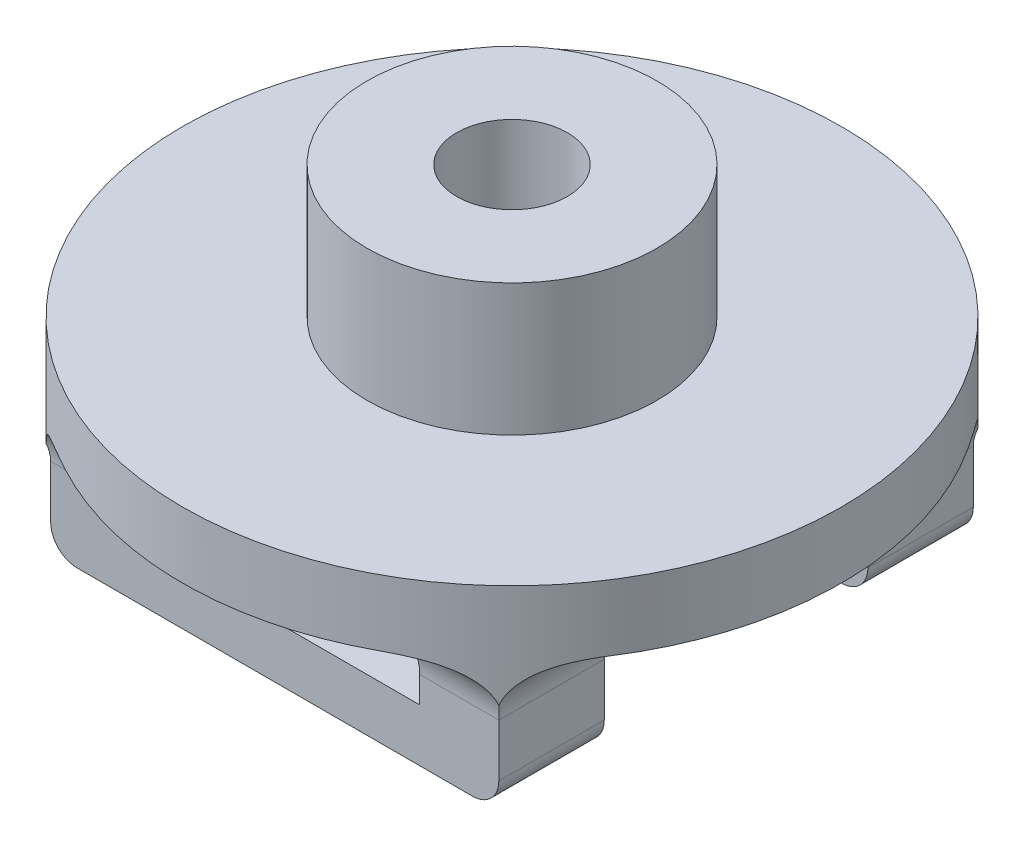
from build123d import *

# Parameters (mm, degrees)
SKETCH1_R                 = 12.5
BOSS_EXTRUDE1_DEPTH       = 2.5
SKETCH2_R                 = 5.5
BOSS_EXTRUDE2_DEPTH       = 5
F_3_0MM_DOWEL_HOLE1_D     = 4.2
F_3_0MM_DOWEL_HOLE1_DEPTH = 10
F_3_0MM_DOWEL_HOLE1_TIP   = 1.2618073
BOSS_EXTRUDE3_START       = -3
BOSS_EXTRUDE3_DEPTH       = 4
FILLET1_R                 = 2
FILLET2_R                 = 1


with BuildPart() as part:
    # Sketch1 → Boss-Extrude1 (new body)
    with BuildSketch(Plane(origin=(0, 0, 0), x_dir=(1, 0, 0), z_dir=(0, 1, 0))):
        with Locations(Location((0, 0, 0), (0, 0, 270))):
            Circle(SKETCH1_R)
    extrude(amount=BOSS_EXTRUDE1_DEPTH)

    # Sketch2 → Boss-Extrude2 (add)
    with BuildSketch(Plane(origin=(0, 2.5, 0), x_dir=(1, 0, 0), z_dir=(0, 1, 0))):
        with Locations(Location((0, 0, 0), (0, 0, 270))):
            Circle(SKETCH2_R)
    extrude(amount=BOSS_EXTRUDE2_DEPTH)

    # Ø3.0mm Dowel Hole1
    with Locations(Plane(origin=(0, 0, 0), x_dir=(-1, 0, 0), z_dir=(0, -1, 0))):
        with Locations((0, 0)):
            Hole(F_3_0MM_DOWEL_HOLE1_D / 2, depth=F_3_0MM_DOWEL_HOLE1_DEPTH)
            with Locations((0, 0, -(F_3_0MM_DOWEL_HOLE1_DEPTH + F_3_0MM_DOWEL_HOLE1_TIP / 2))):  # 118° drill point
                Cone(0, F_3_0MM_DOWEL_HOLE1_D / 2, F_3_0MM_DOWEL_HOLE1_TIP, mode=Mode.SUBTRACT)

    # Sketch6 → Boss-Extrude3 (add)
    with BuildSketch(Plane.XY.offset(8).offset(BOSS_EXTRUDE3_START)):
        Polygon((-5.5, 0), (-8.5, 0), (-8.5, -5), (8.5, -5), (8.5, 0), (5.5, 0), (5.5, -3), (-5.5, -3), align=None)
    boss_extrude3 = extrude(amount=BOSS_EXTRUDE3_DEPTH)

    # Mirror1: Boss-Extrude3 across plane
    add(boss_extrude3.mirror(Plane.XY))

    # Fillet1
    # the kernel refuses this fillet: 2 mm, written as the material it adds along each edge
    with BuildSketch(Plane(origin=(8.5, 0, 5), x_dir=(1, 0, 0), z_dir=(0, 0, 1))) as fillet1_piece_1_section:
        with BuildLine():
            CenterArc((FILLET1_R, -FILLET1_R), FILLET1_R, 90, 90)
            Line((0, -FILLET1_R), (0, 0))
            Line((0, 0), (FILLET1_R, 0))
        make_face()
    fillet1_piece_1 = extrude(amount=4, mode=Mode.PRIVATE)
    fillet1_piece_1 = fillet1_piece_1 & Plane(origin=(0, -0.480708784, 0), x_dir=(0, 0, 1), z_dir=(0, -1, 0)) * Cylinder(12.5, 16, mode=Mode.PRIVATE)
    add(fillet1_piece_1)
    with BuildSketch(Plane(origin=(8.5, 0, 9), x_dir=(0, 0, 1), z_dir=(-1, 0, 0))) as fillet1_piece_2_section:
        with BuildLine():
            CenterArc((FILLET1_R, -FILLET1_R), FILLET1_R, 90, 90)
            Line((0, -FILLET1_R), (0, 0))
            Line((0, 0), (FILLET1_R, 0))
        make_face()
    fillet1_piece_2 = extrude(amount=3, mode=Mode.PRIVATE)
    fillet1_piece_2 = fillet1_piece_2 & Plane(origin=(0, -0.497609904, 0), x_dir=(0, 0, 1), z_dir=(0, -1, 0)) * Cylinder(12.5, 14, mode=Mode.PRIVATE)
    add(fillet1_piece_2)
    with BuildSketch(Plane(origin=(-5.5, 0, 9), x_dir=(0, 0, 1), z_dir=(-1, 0, 0))) as fillet1_piece_3_section:
        with BuildLine():
            CenterArc((FILLET1_R, -FILLET1_R), FILLET1_R, 90, 90)
            Line((0, -FILLET1_R), (0, 0))
            Line((0, 0), (FILLET1_R, 0))
        make_face()
    fillet1_piece_3 = extrude(amount=3, mode=Mode.PRIVATE)
    fillet1_piece_3 = fillet1_piece_3 & Plane(origin=(0, -0.497609936, 0), x_dir=(0, 0, 1), z_dir=(0, -1, 0)) * Cylinder(12.5, 14, mode=Mode.PRIVATE)
    add(fillet1_piece_3)
    with BuildSketch(Plane(origin=(-8.5, 0, 5), x_dir=(-1, 0, 0), z_dir=(0, 0, 1))) as fillet1_piece_4_section:
        with BuildLine():
            CenterArc((FILLET1_R, FILLET1_R), FILLET1_R, 180, 90)
            Line((0, FILLET1_R), (0, 0))
            Line((0, 0), (FILLET1_R, 0))
        make_face()
    fillet1_piece_4 = extrude(amount=4, mode=Mode.PRIVATE)
    fillet1_piece_4 = fillet1_piece_4 & Plane(origin=(0, -0.48070882, 0), x_dir=(0, 0, 1), z_dir=(0, -1, 0)) * Cylinder(12.5, 16, mode=Mode.PRIVATE)
    add(fillet1_piece_4)
    with BuildSketch(Plane(origin=(8.5, 0, 5), x_dir=(0, 0, -1), z_dir=(-1, 0, 0)), Plane(origin=(-5.5, 0, 5), x_dir=(0, 0, -1), z_dir=(-1, 0, 0))) as fillet1_piece_5:
        with BuildLine():
            CenterArc((FILLET1_R, FILLET1_R), FILLET1_R, 180, 90)
            Line((0, FILLET1_R), (0, 0))
            Line((0, 0), (FILLET1_R, 0))
        make_face()
    extrude(amount=3)
    with BuildSketch(Plane(origin=(8.5, 0, -5), x_dir=(0, 0, 1), z_dir=(-1, 0, 0)), Plane(origin=(-5.5, 0, -5), x_dir=(0, 0, 1), z_dir=(-1, 0, 0))) as fillet1_piece_6:
        with BuildLine():
            CenterArc((FILLET1_R, -FILLET1_R), FILLET1_R, 90, 90)
            Line((0, -FILLET1_R), (0, 0))
            Line((0, 0), (FILLET1_R, 0))
        make_face()
    extrude(amount=3)
    with BuildSketch(Plane(origin=(8.5, 0, -5), x_dir=(1, 0, 0), z_dir=(0, 0, -1))) as fillet1_piece_7_section:
        with BuildLine():
            CenterArc((FILLET1_R, FILLET1_R), FILLET1_R, 180, 90)
            Line((0, FILLET1_R), (0, 0))
            Line((0, 0), (FILLET1_R, 0))
        make_face()
    fillet1_piece_7 = extrude(amount=4, mode=Mode.PRIVATE)
    fillet1_piece_7 = fillet1_piece_7 & Plane(origin=(0, -0.48070882, 0), x_dir=(0, 0, 1), z_dir=(0, -1, 0)) * Cylinder(12.5, 16, mode=Mode.PRIVATE)
    add(fillet1_piece_7)
    with BuildSketch(Plane(origin=(-8.5, 0, -5), x_dir=(-1, 0, 0), z_dir=(0, 0, -1))) as fillet1_piece_8_section:
        with BuildLine():
            CenterArc((FILLET1_R, -FILLET1_R), FILLET1_R, 90, 90)
            Line((0, -FILLET1_R), (0, 0))
            Line((0, 0), (FILLET1_R, 0))
        make_face()
    fillet1_piece_8 = extrude(amount=4, mode=Mode.PRIVATE)
    fillet1_piece_8 = fillet1_piece_8 & Plane(origin=(0, -0.480708785, 0), x_dir=(0, 0, 1), z_dir=(0, -1, 0)) * Cylinder(12.5, 16, mode=Mode.PRIVATE)
    add(fillet1_piece_8)
    with BuildSketch(Plane(origin=(8.5, 0, -9), x_dir=(0, 0, -1), z_dir=(-1, 0, 0))) as fillet1_piece_9_section:
        with BuildLine():
            CenterArc((FILLET1_R, FILLET1_R), FILLET1_R, 180, 90)
            Line((0, FILLET1_R), (0, 0))
            Line((0, 0), (FILLET1_R, 0))
        make_face()
    fillet1_piece_9 = extrude(amount=3, mode=Mode.PRIVATE)
    fillet1_piece_9 = fillet1_piece_9 & Plane(origin=(0, -0.497609946, 0), x_dir=(0, 0, 1), z_dir=(0, -1, 0)) * Cylinder(12.5, 14, mode=Mode.PRIVATE)
    add(fillet1_piece_9)
    with BuildSketch(Plane(origin=(-5.5, 0, -9), x_dir=(0, 0, -1), z_dir=(-1, 0, 0))) as fillet1_piece_10_section:
        with BuildLine():
            CenterArc((FILLET1_R, FILLET1_R), FILLET1_R, 180, 90)
            Line((0, FILLET1_R), (0, 0))
            Line((0, 0), (FILLET1_R, 0))
        make_face()
    fillet1_piece_10 = extrude(amount=3, mode=Mode.PRIVATE)
    fillet1_piece_10 = fillet1_piece_10 & Plane(origin=(0, -0.497609939, 0), x_dir=(0, 0, 1), z_dir=(0, -1, 0)) * Cylinder(12.5, 14, mode=Mode.PRIVATE)
    add(fillet1_piece_10)
    with BuildSketch(Plane(origin=(13.5, 0, 5), x_dir=(0, 0, -1), z_dir=(-1, 0, 0))) as fillet1_piece_11a_section:
        with BuildLine():
            CenterArc((FILLET1_R, FILLET1_R), FILLET1_R, 180, 90)
            Line((0, FILLET1_R), (0, 0))
            Line((0, 0), (FILLET1_R, 0))
        make_face()
    fillet1_piece_11a = extrude(amount=8, mode=Mode.PRIVATE)
    fillet1_piece_11a = fillet1_piece_11a & Plane(origin=(0, -0.439550535, 0), x_dir=(0, 0, 1), z_dir=(0, -1, 0)) * Cylinder(12.5, 24, mode=Mode.PRIVATE)
    fillet1_piece_11a = split(fillet1_piece_11a, bisect_by=Plane(origin=(8.5, -0.439550535, 4.525411001), z_dir=(1, 0, 0)), keep=Keep.TOP, mode=Mode.PRIVATE)
    with BuildSketch(Plane(origin=(8.5, 0, 0), x_dir=(1, 0, 0), z_dir=(0, 0, 1))) as fillet1_piece_11b_section:
        with BuildLine():
            CenterArc((FILLET1_R, -FILLET1_R), FILLET1_R, 90, 90)
            Line((0, -FILLET1_R), (0, 0))
            Line((0, 0), (FILLET1_R, 0))
        make_face()
    fillet1_piece_11b = extrude(amount=9, mode=Mode.PRIVATE)
    fillet1_piece_11b = split(fillet1_piece_11b, bisect_by=Plane(origin=(8.952790229, -0.452790229, 5), z_dir=(0, 0, -1)), keep=Keep.TOP, mode=Mode.PRIVATE)
    fillet1_piece_11 = fillet1_piece_11a & fillet1_piece_11b
    add(fillet1_piece_11)
    with BuildSketch(Plane(origin=(8.5, 0, 5), x_dir=(1, 0, 0), z_dir=(0, 0, 1))) as fillet1_piece_12a_section:
        with BuildLine():
            CenterArc((FILLET1_R, -FILLET1_R), FILLET1_R, 90, 90)
            Line((0, -FILLET1_R), (0, 0))
            Line((0, 0), (FILLET1_R, 0))
        make_face()
    fillet1_piece_12a = extrude(amount=9, mode=Mode.PRIVATE)
    fillet1_piece_12a = fillet1_piece_12a & Plane(origin=(0, -0.851863441, 0), x_dir=(0, 0, 1), z_dir=(0, -1, 0)) * Cylinder(12.5, 26, mode=Mode.PRIVATE)
    fillet1_piece_12a = split(fillet1_piece_12a, bisect_by=Plane(origin=(8.524607879, -0.851863441, 9), z_dir=(0, 0, 1)), keep=Keep.TOP, mode=Mode.PRIVATE)
    with BuildSketch(Plane(origin=(13.5, 0, 9), x_dir=(0, 0, 1), z_dir=(-1, 0, 0))) as fillet1_piece_12b_section:
        with BuildLine():
            CenterArc((FILLET1_R, -FILLET1_R), FILLET1_R, 90, 90)
            Line((0, -FILLET1_R), (0, 0))
            Line((0, 0), (FILLET1_R, 0))
        make_face()
    fillet1_piece_12b = extrude(amount=8, mode=Mode.PRIVATE)
    fillet1_piece_12b = fillet1_piece_12b & Plane(origin=(0, -0.857818141, 0), x_dir=(0, 0, 1), z_dir=(0, -1, 0)) * Cylinder(12.5, 24, mode=Mode.PRIVATE)
    fillet1_piece_12b = split(fillet1_piece_12b, bisect_by=Plane(origin=(8.5, -0.857818141, 9.021962646), z_dir=(1, 0, 0)), keep=Keep.TOP, mode=Mode.PRIVATE)
    fillet1_piece_12 = fillet1_piece_12a & fillet1_piece_12b
    add(fillet1_piece_12)
    with BuildSketch(Plane(origin=(-8.5, 0, 5), x_dir=(-1, 0, 0), z_dir=(0, 0, 1))) as fillet1_piece_13a_section:
        with BuildLine():
            CenterArc((FILLET1_R, FILLET1_R), FILLET1_R, 180, 90)
            Line((0, FILLET1_R), (0, 0))
            Line((0, 0), (FILLET1_R, 0))
        make_face()
    fillet1_piece_13a = extrude(amount=9, mode=Mode.PRIVATE)
    fillet1_piece_13a = fillet1_piece_13a & Plane(origin=(0, -0.851863441, 0), x_dir=(0, 0, 1), z_dir=(0, -1, 0)) * Cylinder(12.5, 26, mode=Mode.PRIVATE)
    fillet1_piece_13a = split(fillet1_piece_13a, bisect_by=Plane(origin=(-8.524607879, -0.851863441, 9), z_dir=(0, 0, 1)), keep=Keep.TOP, mode=Mode.PRIVATE)
    with BuildSketch(Plane(origin=(-5.5, 0, 9), x_dir=(0, 0, 1), z_dir=(-1, 0, 0))) as fillet1_piece_13b_section:
        with BuildLine():
            CenterArc((FILLET1_R, -FILLET1_R), FILLET1_R, 90, 90)
            Line((0, -FILLET1_R), (0, 0))
            Line((0, 0), (FILLET1_R, 0))
        make_face()
    fillet1_piece_13b = extrude(amount=8, mode=Mode.PRIVATE)
    fillet1_piece_13b = fillet1_piece_13b & Plane(origin=(0, -0.857818141, 0), x_dir=(0, 0, 1), z_dir=(0, -1, 0)) * Cylinder(12.5, 24, mode=Mode.PRIVATE)
    fillet1_piece_13b = split(fillet1_piece_13b, bisect_by=Plane(origin=(-8.5, -0.857818141, 9.021962647), z_dir=(-1, 0, 0)), keep=Keep.TOP, mode=Mode.PRIVATE)
    fillet1_piece_13 = fillet1_piece_13a & fillet1_piece_13b
    add(fillet1_piece_13)
    with BuildSketch(Plane(origin=(-5.5, 0, 5), x_dir=(0, 0, -1), z_dir=(-1, 0, 0))) as fillet1_piece_14a_section:
        with BuildLine():
            CenterArc((FILLET1_R, FILLET1_R), FILLET1_R, 180, 90)
            Line((0, FILLET1_R), (0, 0))
            Line((0, 0), (FILLET1_R, 0))
        make_face()
    fillet1_piece_14a = extrude(amount=8, mode=Mode.PRIVATE)
    fillet1_piece_14a = fillet1_piece_14a & Plane(origin=(0, -0.439548718, 0), x_dir=(0, 0, 1), z_dir=(0, -1, 0)) * Cylinder(12.5, 24, mode=Mode.PRIVATE)
    fillet1_piece_14a = split(fillet1_piece_14a, bisect_by=Plane(origin=(-8.5, -0.439548718, 4.525414754), z_dir=(-1, 0, 0)), keep=Keep.TOP, mode=Mode.PRIVATE)
    with BuildSketch(Plane(origin=(-8.5, 0, 0), x_dir=(-1, 0, 0), z_dir=(0, 0, 1))) as fillet1_piece_14b_section:
        with BuildLine():
            CenterArc((FILLET1_R, FILLET1_R), FILLET1_R, 180, 90)
            Line((0, FILLET1_R), (0, 0))
            Line((0, 0), (FILLET1_R, 0))
        make_face()
    fillet1_piece_14b = extrude(amount=9, mode=Mode.PRIVATE)
    fillet1_piece_14b = split(fillet1_piece_14b, bisect_by=Plane(origin=(-8.952790229, -0.452790229, 5), z_dir=(0, 0, -1)), keep=Keep.TOP, mode=Mode.PRIVATE)
    fillet1_piece_14 = fillet1_piece_14a & fillet1_piece_14b
    add(fillet1_piece_14)
    with BuildSketch(Plane(origin=(8.5, 0, 0), x_dir=(1, 0, 0), z_dir=(0, 0, -1))) as fillet1_piece_15a_section:
        with BuildLine():
            CenterArc((FILLET1_R, FILLET1_R), FILLET1_R, 180, 90)
            Line((0, FILLET1_R), (0, 0))
            Line((0, 0), (FILLET1_R, 0))
        make_face()
    fillet1_piece_15a = extrude(amount=9, mode=Mode.PRIVATE)
    fillet1_piece_15a = split(fillet1_piece_15a, bisect_by=Plane(origin=(8.952790229, -0.452790229, -5), z_dir=(0, 0, 1)), keep=Keep.TOP, mode=Mode.PRIVATE)
    with BuildSketch(Plane(origin=(13.5, 0, -5), x_dir=(0, 0, 1), z_dir=(-1, 0, 0))) as fillet1_piece_15b_section:
        with BuildLine():
            CenterArc((FILLET1_R, -FILLET1_R), FILLET1_R, 90, 90)
            Line((0, -FILLET1_R), (0, 0))
            Line((0, 0), (FILLET1_R, 0))
        make_face()
    fillet1_piece_15b = extrude(amount=8, mode=Mode.PRIVATE)
    fillet1_piece_15b = fillet1_piece_15b & Plane(origin=(0, -0.439548718, 0), x_dir=(0, 0, 1), z_dir=(0, -1, 0)) * Cylinder(12.5, 24, mode=Mode.PRIVATE)
    fillet1_piece_15b = split(fillet1_piece_15b, bisect_by=Plane(origin=(8.5, -0.439548718, -4.525414754), z_dir=(1, 0, 0)), keep=Keep.TOP, mode=Mode.PRIVATE)
    fillet1_piece_15 = fillet1_piece_15a & fillet1_piece_15b
    add(fillet1_piece_15)
    with BuildSketch(Plane(origin=(8.5, 0, -5), x_dir=(1, 0, 0), z_dir=(0, 0, -1))) as fillet1_piece_16a_section:
        with BuildLine():
            CenterArc((FILLET1_R, FILLET1_R), FILLET1_R, 180, 90)
            Line((0, FILLET1_R), (0, 0))
            Line((0, 0), (FILLET1_R, 0))
        make_face()
    fillet1_piece_16a = extrude(amount=9, mode=Mode.PRIVATE)
    fillet1_piece_16a = fillet1_piece_16a & Plane(origin=(0, -0.85186344, 0), x_dir=(0, 0, 1), z_dir=(0, -1, 0)) * Cylinder(12.5, 26, mode=Mode.PRIVATE)
    fillet1_piece_16a = split(fillet1_piece_16a, bisect_by=Plane(origin=(8.524607879, -0.85186344, -9), z_dir=(0, 0, -1)), keep=Keep.TOP, mode=Mode.PRIVATE)
    with BuildSketch(Plane(origin=(13.5, 0, -9), x_dir=(0, 0, -1), z_dir=(-1, 0, 0))) as fillet1_piece_16b_section:
        with BuildLine():
            CenterArc((FILLET1_R, FILLET1_R), FILLET1_R, 180, 90)
            Line((0, FILLET1_R), (0, 0))
            Line((0, 0), (FILLET1_R, 0))
        make_face()
    fillet1_piece_16b = extrude(amount=8, mode=Mode.PRIVATE)
    fillet1_piece_16b = fillet1_piece_16b & Plane(origin=(0, -0.85781814, 0), x_dir=(0, 0, 1), z_dir=(0, -1, 0)) * Cylinder(12.5, 24, mode=Mode.PRIVATE)
    fillet1_piece_16b = split(fillet1_piece_16b, bisect_by=Plane(origin=(8.5, -0.85781814, -9.021962646), z_dir=(1, 0, 0)), keep=Keep.TOP, mode=Mode.PRIVATE)
    fillet1_piece_16 = fillet1_piece_16a & fillet1_piece_16b
    add(fillet1_piece_16)
    with BuildSketch(Plane(origin=(-8.5, 0, 0), x_dir=(-1, 0, 0), z_dir=(0, 0, -1))) as fillet1_piece_17a_section:
        with BuildLine():
            CenterArc((FILLET1_R, -FILLET1_R), FILLET1_R, 90, 90)
            Line((0, -FILLET1_R), (0, 0))
            Line((0, 0), (FILLET1_R, 0))
        make_face()
    fillet1_piece_17a = extrude(amount=9, mode=Mode.PRIVATE)
    fillet1_piece_17a = split(fillet1_piece_17a, bisect_by=Plane(origin=(-8.952790229, -0.452790229, -5), z_dir=(0, 0, 1)), keep=Keep.TOP, mode=Mode.PRIVATE)
    with BuildSketch(Plane(origin=(-5.5, 0, -5), x_dir=(0, 0, 1), z_dir=(-1, 0, 0))) as fillet1_piece_17b_section:
        with BuildLine():
            CenterArc((FILLET1_R, -FILLET1_R), FILLET1_R, 90, 90)
            Line((0, -FILLET1_R), (0, 0))
            Line((0, 0), (FILLET1_R, 0))
        make_face()
    fillet1_piece_17b = extrude(amount=8, mode=Mode.PRIVATE)
    fillet1_piece_17b = fillet1_piece_17b & Plane(origin=(0, -0.439550535, 0), x_dir=(0, 0, 1), z_dir=(0, -1, 0)) * Cylinder(12.5, 24, mode=Mode.PRIVATE)
    fillet1_piece_17b = split(fillet1_piece_17b, bisect_by=Plane(origin=(-8.5, -0.439550535, -4.525411001), z_dir=(-1, 0, 0)), keep=Keep.TOP, mode=Mode.PRIVATE)
    fillet1_piece_17 = fillet1_piece_17a & fillet1_piece_17b
    add(fillet1_piece_17)
    with BuildSketch(Plane(origin=(-5.5, 0, -9), x_dir=(0, 0, -1), z_dir=(-1, 0, 0))) as fillet1_piece_18a_section:
        with BuildLine():
            CenterArc((FILLET1_R, FILLET1_R), FILLET1_R, 180, 90)
            Line((0, FILLET1_R), (0, 0))
            Line((0, 0), (FILLET1_R, 0))
        make_face()
    fillet1_piece_18a = extrude(amount=8, mode=Mode.PRIVATE)
    fillet1_piece_18a = fillet1_piece_18a & Plane(origin=(0, -0.857818141, 0), x_dir=(0, 0, 1), z_dir=(0, -1, 0)) * Cylinder(12.5, 24, mode=Mode.PRIVATE)
    fillet1_piece_18a = split(fillet1_piece_18a, bisect_by=Plane(origin=(-8.5, -0.857818141, -9.021962647), z_dir=(-1, 0, 0)), keep=Keep.TOP, mode=Mode.PRIVATE)
    with BuildSketch(Plane(origin=(-8.5, 0, -5), x_dir=(-1, 0, 0), z_dir=(0, 0, -1))) as fillet1_piece_18b_section:
        with BuildLine():
            CenterArc((FILLET1_R, -FILLET1_R), FILLET1_R, 90, 90)
            Line((0, -FILLET1_R), (0, 0))
            Line((0, 0), (FILLET1_R, 0))
        make_face()
    fillet1_piece_18b = extrude(amount=9, mode=Mode.PRIVATE)
    fillet1_piece_18b = fillet1_piece_18b & Plane(origin=(0, -0.851863441, 0), x_dir=(0, 0, 1), z_dir=(0, -1, 0)) * Cylinder(12.5, 26, mode=Mode.PRIVATE)
    fillet1_piece_18b = split(fillet1_piece_18b, bisect_by=Plane(origin=(-8.524607879, -0.851863441, -9), z_dir=(0, 0, -1)), keep=Keep.TOP, mode=Mode.PRIVATE)
    fillet1_piece_18 = fillet1_piece_18a & fillet1_piece_18b
    add(fillet1_piece_18)

    # Fillet2
    fillet2_edges = [part.edges().sort_by_distance(p)[0] for p in [
        (-8.5, -5, 7),
        (8.5, -5, 7),
        (8.5, -5, -7),
        (-8.5, -5, -7),
    ]]
    fillet(fillet2_edges, radius=FILLET2_R)


solid = part.part
